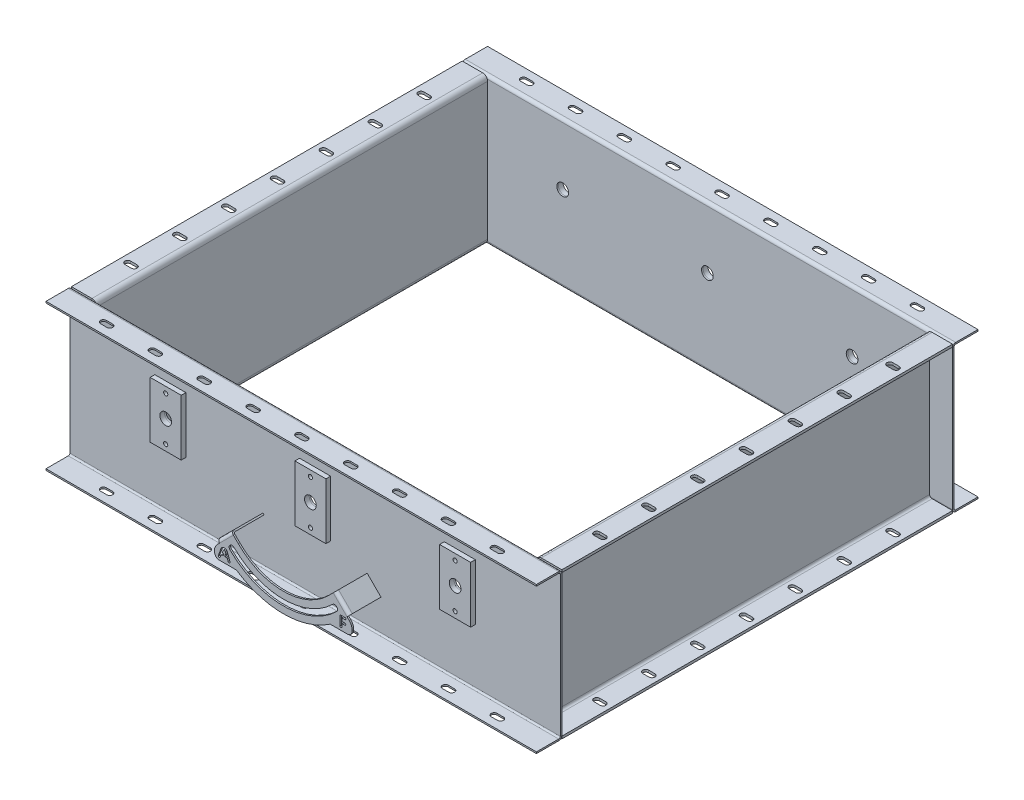
from build123d import *

# Parameters (mm, degrees)
ESBO_O7_W                                      = 5
ESBO_O7_H                                      = 300
FLANGE_BASE2_DEPTH                             = 400
ARESTA_FLANGE1_STRIP_W                         = 30
ARESTA_FLANGE1_STRIP_H                         = 5
ARESTA_FLANGE1_STRIP_CUT_DEPTH                 = 800
ARESTA_FLANGE1_STRIP_2_W                       = 30
ARESTA_FLANGE1_STRIP_2_H                       = 5
ARESTA_FLANGE1_STRIP_CUT_2_DEPTH               = 800
ARESTA_FLANGE1_DEPTH                           = 800
ARESTA_FLANGE1_BEND_DEPTH                      = 800
CORTE_EXTRUS_O2_DEPTH                          = 709.522406138
PADR_O_LINEAR5_COUNT                           = 4
PADR_O_LINEAR5_PITCH                           = 100
PADR_O_LINEAR5_COL_COUNT                       = 4
PADR_O_LINEAR5_COL_PITCH                       = 100
PADR_OCIRCULAR1_COUNT                          = 2
FLANGE_BASE3_START                             = -502
ESBO_O20_W                                     = 3.18
ESBO_O20_H                                     = 300
FLANGE_BASE3_DEPTH                             = 1004
ARESTA_FLANGE2_STRIP_W                         = 19.08
ARESTA_FLANGE2_STRIP_H                         = 3.18
ARESTA_FLANGE2_STRIP_CUT_DEPTH                 = 1004
ARESTA_FLANGE2_STRIP_2_W                       = 19.08
ARESTA_FLANGE2_STRIP_2_H                       = 3.18
ARESTA_FLANGE2_STRIP_CUT_2_DEPTH               = 1004
ARESTA_FLANGE2_DEPTH                           = 1004
ARESTA_FLANGE2_BEND_DEPTH                      = 1004
CORTE_EXTRUS_O3_DEPTH                          = 740.126511499
PADR_O_LINEAR6_COUNT                           = 5
PADR_O_LINEAR6_PITCH                           = 100
PADR_O_LINEAR6_COL_COUNT                       = 5
PADR_O_LINEAR6_COL_PITCH                       = 100
PADR_OCIRCULAR2_COUNT                          = 2
ESBO_O18_W                                     = 9.525
ESBO_O18_H                                     = 63.5
BARRA_CHATA_ASTM_A36_BR_09_53_X_63_50_A3_DEPTH = 115
ESBO_O34_W                                     = 4.25
ESBO_O34_H                                     = 9.526
FURO_ROSCADO_DE_M101_AT_2_COUNT                = 2
FURO_ROSCADO_DE_M101_AT_2_PITCH                = 90
PADR_O_LINEAR1_COUNT                           = 2
PADR_O_LINEAR1_PITCH                           = 296.25
ESBO_O32_R                                     = 12
CORTE_EXTRUS_O1_DEPTH                          = 1044.895941665
FLANGE_BASE4_DEPTH                             = 3.18
ARESTA_FLANGE3_STRIP_W                         = 19.08
ARESTA_FLANGE3_STRIP_H                         = 3.18
ARESTA_FLANGE3_STRIP_CUT_DEPTH                 = 40
ARESTA_FLANGE3_STRIP_2_W                       = 19.08
ARESTA_FLANGE3_STRIP_2_H                       = 3.18
ARESTA_FLANGE3_STRIP_CUT_2_DEPTH               = 40
ARESTA_FLANGE3_DEPTH                           = 40
ARESTA_FLANGE3_BEND_DEPTH                      = 40
ABA2_DEPTH                                     = 3.18
CORTE_EXTRUS_O4_DEPTH                          = 3.18
FILETE1_R                                      = 20
FILETE2_R                                      = 10
CORTE_EXTRUS_O5_DEPTH                          = 3.18


# Sheet-metal steps are written as plain solids
with BuildPart() as part:
    # Flange-base2: sheet metal written as solids
    # Esboço7 → Flange-base2 (new, symmetric)
    with BuildSketch(Plane.XY):
        with Locations((-452.5, -150)):
            Rectangle(ESBO_O7_W, ESBO_O7_H)
    extrude(amount=FLANGE_BASE2_DEPTH, both=True)

    # Aresta-Flange1: sheet metal written as solids
    # Aresta-Flange1 strip (on a plane across the edge) → Aresta-Flange1 strip cut (cut)
    with BuildSketch(Plane(origin=(-455, 0, 400), x_dir=(0, -1, 0), z_dir=(0, 0, -1))):
        with Locations((-5, -2.5)):
            Rectangle(ARESTA_FLANGE1_STRIP_W, ARESTA_FLANGE1_STRIP_H)
    extrude(amount=ARESTA_FLANGE1_STRIP_CUT_DEPTH, mode=Mode.SUBTRACT)

    # Aresta-Flange1 strip 2 (on a plane across the edge) → Aresta-Flange1 strip cut 2 (cut)
    with BuildSketch(Plane(origin=(-455, -300, -400), x_dir=(0, 1, 0), z_dir=(0, 0, 1))):
        with Locations((-5, -2.5)):
            Rectangle(ARESTA_FLANGE1_STRIP_2_W, ARESTA_FLANGE1_STRIP_2_H)
    extrude(amount=ARESTA_FLANGE1_STRIP_CUT_2_DEPTH, mode=Mode.SUBTRACT)

    # Aresta-Flange1 section (on a plane across the edge) → Aresta-Flange1 (add)
    with BuildSketch(Plane(origin=(-455, 0, 400), x_dir=(0, -1, 0), z_dir=(0, 0, -1))):
        with BuildLine():
            Line((0, 5), (0, 47))
            Line((0, 47), (5, 47))
            Line((5, 47), (5, 5))
            ThreePointArc((5, 5), (6.464466094, 1.464466094), (10, 0))
            Line((10, 0), (10, -5))
            ThreePointArc((10, -5), (2.928932188, -2.071067812), (0, 5))
        make_face()
    extrude(amount=ARESTA_FLANGE1_DEPTH)

    # Aresta-Flange1 section 2 (on a plane across the edge) → Aresta-Flange1 bend (add)
    with BuildSketch(Plane(origin=(-455, -300, -400), x_dir=(0, 1, 0), z_dir=(0, 0, 1))):
        with BuildLine():
            Line((0, 5), (0, 47))
            Line((0, 47), (5, 47))
            Line((5, 47), (5, 5))
            ThreePointArc((5, 5), (6.464466094, 1.464466094), (10, 0))
            Line((10, 0), (10, -5))
            ThreePointArc((10, -5), (2.928932188, -2.071067812), (0, 5))
        make_face()
    extrude(amount=ARESTA_FLANGE1_BEND_DEPTH)

    # Esboço52 → Corte-extrusão2 (cut, through all)
    with BuildSketch(Plane(origin=(0, 0, 0), x_dir=(1, 0, 0), z_dir=(0, 1, 0))):
        with BuildLine():
            Line((-486.5, 6), (-473.5, 6))
            ThreePointArc((-473.5, 6), (-467.5, 0), (-473.5, -6))
            Line((-473.5, -6), (-486.5, -6))
            ThreePointArc((-486.5, -6), (-492.5, 0), (-486.5, 6))
        make_face()
    corte_extrus_o2 = extrude(amount=-CORTE_EXTRUS_O2_DEPTH, mode=Mode.SUBTRACT)

    # Padrão linear5: Corte-extrusão2 ×4
    with Locations(*[(0, 0, -i * PADR_O_LINEAR5_PITCH) for i in range(1, PADR_O_LINEAR5_COUNT)]):
        add(corte_extrus_o2, mode=Mode.SUBTRACT)

    # Padrão linear5 col: Corte-extrusão2 ×4
    with Locations(*[(0, 0, i * PADR_O_LINEAR5_COL_PITCH) for i in range(1, PADR_O_LINEAR5_COL_COUNT)]):
        add(corte_extrus_o2, mode=Mode.SUBTRACT)


with BuildPart() as padr_ocircular1_1:
    # PadrãoCircular1: pattern copy
    add(part.part.rotate(Axis((0, 0, 0), (0, 1, 0)), 1 * 360 / PADR_OCIRCULAR1_COUNT))


with BuildPart() as body_3:
    # Flange-base3: sheet metal written as solids
    # Esboço20 → Flange-base3 (new body)
    with BuildSketch(Plane(origin=(0, 0, 0), x_dir=(0, 0, -1), z_dir=(1, 0, 0)).offset(FLANGE_BASE3_START)):
        with Locations((-401.59, -150)):
            Rectangle(ESBO_O20_W, ESBO_O20_H)
    extrude(amount=FLANGE_BASE3_DEPTH)

    # Aresta-Flange2: sheet metal written as solids
    # Aresta-Flange2 strip (on a plane across the edge) → Aresta-Flange2 strip cut (cut)
    with BuildSketch(Plane(origin=(502, 0, 403.18), x_dir=(0, -1, 0), z_dir=(-1, 0, 0))):
        with Locations((-3.18, -1.59)):
            Rectangle(ARESTA_FLANGE2_STRIP_W, ARESTA_FLANGE2_STRIP_H)
    extrude(amount=ARESTA_FLANGE2_STRIP_CUT_DEPTH, mode=Mode.SUBTRACT)

    # Aresta-Flange2 strip 2 (on a plane across the edge) → Aresta-Flange2 strip cut 2 (cut)
    with BuildSketch(Plane(origin=(-502, -300, 403.18), x_dir=(0, 1, 0), z_dir=(1, 0, 0))):
        with Locations((-3.18, -1.59)):
            Rectangle(ARESTA_FLANGE2_STRIP_2_W, ARESTA_FLANGE2_STRIP_2_H)
    extrude(amount=ARESTA_FLANGE2_STRIP_CUT_2_DEPTH, mode=Mode.SUBTRACT)

    # Aresta-Flange2 section (on a plane across the edge) → Aresta-Flange2 (add)
    with BuildSketch(Plane(origin=(502, 0, 403.18), x_dir=(0, -1, 0), z_dir=(-1, 0, 0))):
        with BuildLine():
            Line((0, 3.18), (0, 48.82))
            Line((0, 48.82), (3.18, 48.82))
            Line((3.18, 48.82), (3.18, 3.18))
            ThreePointArc((3.18, 3.18), (4.111400436, 0.931400436), (6.36, 0))
            Line((6.36, 0), (6.36, -3.18))
            ThreePointArc((6.36, -3.18), (1.862800872, -1.317199128), (0, 3.18))
        make_face()
    extrude(amount=ARESTA_FLANGE2_DEPTH)

    # Aresta-Flange2 section 2 (on a plane across the edge) → Aresta-Flange2 bend (add)
    with BuildSketch(Plane(origin=(-502, -300, 403.18), x_dir=(0, 1, 0), z_dir=(1, 0, 0))):
        with BuildLine():
            Line((0, 3.18), (0, 48.82))
            Line((0, 48.82), (3.18, 48.82))
            Line((3.18, 48.82), (3.18, 3.18))
            ThreePointArc((3.18, 3.18), (4.111400436, 0.931400436), (6.36, 0))
            Line((6.36, 0), (6.36, -3.18))
            ThreePointArc((6.36, -3.18), (1.862800872, -1.317199128), (0, 3.18))
        make_face()
    extrude(amount=ARESTA_FLANGE2_BEND_DEPTH)

    # Esboço53 → Corte-extrusão3 (cut, through all)
    with BuildSketch(Plane(origin=(0, 0, 0), x_dir=(1, 0, 0), z_dir=(0, 1, 0))):
        with BuildLine():
            Line((-6.5, -424), (6.5, -424))
            ThreePointArc((6.5, -424), (12.5, -430), (6.5, -436))
            Line((6.5, -436), (-6.5, -436))
            ThreePointArc((-6.5, -436), (-12.5, -430), (-6.5, -424))
        make_face()
    corte_extrus_o3 = extrude(amount=-CORTE_EXTRUS_O3_DEPTH, mode=Mode.SUBTRACT)

    # Padrão linear6: Corte-extrusão3 ×5
    with Locations(*[(i * PADR_O_LINEAR6_PITCH, 0, 0) for i in range(1, PADR_O_LINEAR6_COUNT)]):
        add(corte_extrus_o3, mode=Mode.SUBTRACT)

    # Padrão linear6 col: Corte-extrusão3 ×5
    with Locations(*[(-i * PADR_O_LINEAR6_COL_PITCH, 0, 0) for i in range(1, PADR_O_LINEAR6_COL_COUNT)]):
        add(corte_extrus_o3, mode=Mode.SUBTRACT)


with BuildPart() as padr_ocircular2_1:
    # PadrãoCircular2: pattern copy
    add(body_3.part.rotate(Axis((0, 0, 0), (0, 1, 0)), 1 * 360 / PADR_OCIRCULAR2_COUNT))


with BuildPart() as body_5:
    # Esboço18 → Barra chata astm a36 BR 09,53 X 63,50 A36(1) (new body)
    with BuildSketch(Plane(origin=(-296.25, -67.5, 407.9425), x_dir=(0, 0, 1), z_dir=(0, -1, 0))):
        Rectangle(ESBO_O18_W, ESBO_O18_H)
    extrude(amount=BARRA_CHATA_ASTM_A36_BR_09_53_X_63_50_A3_DEPTH)

    # Esboço34 → Furo roscado de M101 (revolve, cut)
    with BuildSketch(Plane(origin=(-296.25, -80, 412.705), x_dir=(0, -1, 0), z_dir=(1, 0, 0))):
        with Locations((2.125, 4.763)):
            Rectangle(ESBO_O34_W, ESBO_O34_H)
    furo_roscado_de_m101 = revolve(axis=Axis((-296.25, -80, 419.055), (0, 0, -1)), mode=Mode.SUBTRACT)

    # Furo roscado de M101 at 2: Furo roscado de M101 ×2
    with Locations(*[(0, -i * FURO_ROSCADO_DE_M101_AT_2_PITCH, 0) for i in range(1, FURO_ROSCADO_DE_M101_AT_2_COUNT)]):
        add(furo_roscado_de_m101, mode=Mode.SUBTRACT)


with BuildPart() as body_6:
    # Espelhar1: mirrored copy
    add(body_5.part.mirror(Plane(origin=(0, 0, 0), x_dir=(0, 0, 1), z_dir=(1, 0, 0))))


with BuildPart() as padr_o_linear1_1:
    # Padrão linear1: pattern copy
    add(body_5.part.moved(Location(Vector(1, 0, 0) * (1 * PADR_O_LINEAR1_PITCH))))


with BuildPart() as body_8:
    # Espelhar2: mirrored copy
    add(body_5.part.mirror(Plane.XY))


with BuildPart() as body_9:
    # Espelhar2 2: mirrored copy
    add(body_6.part.mirror(Plane.XY))


with BuildPart() as body_10:
    # Espelhar2 3: mirrored copy
    add(padr_o_linear1_1.part.mirror(Plane.XY))


with BuildPart() as corte_extrus_o1_tool:
    # Esboço32 → Corte-extrusão1 (new, through all)
    with BuildSketch(Plane.XY.offset(412.705)):
        with Locations((-296.25, -125)):
            Circle(ESBO_O32_R)
        with Locations((296.25, -125)):
            Circle(ESBO_O32_R)
        with Locations((0, -125)):
            Circle(ESBO_O32_R)
    extrude(amount=-CORTE_EXTRUS_O1_DEPTH)


with BuildPart() as body_3_1:
    add(body_3.part)

    # Corte-extrusão1: cut by corte_extrus_o1_tool
    add(corte_extrus_o1_tool.part, mode=Mode.SUBTRACT)


with BuildPart() as padr_ocircular2_1_1:
    add(padr_ocircular2_1.part)

    # Corte-extrusão1: cut by corte_extrus_o1_tool
    add(corte_extrus_o1_tool.part, mode=Mode.SUBTRACT)


with BuildPart() as body_5_1:
    add(body_5.part)

    # Corte-extrusão1: cut by corte_extrus_o1_tool
    add(corte_extrus_o1_tool.part, mode=Mode.SUBTRACT)


with BuildPart() as body_6_1:
    add(body_6.part)

    # Corte-extrusão1: cut by corte_extrus_o1_tool
    add(corte_extrus_o1_tool.part, mode=Mode.SUBTRACT)


with BuildPart() as padr_o_linear1_1_1:
    add(padr_o_linear1_1.part)

    # Corte-extrusão1: cut by corte_extrus_o1_tool
    add(corte_extrus_o1_tool.part, mode=Mode.SUBTRACT)


with BuildPart() as body_8_1:
    add(body_8.part)

    # Corte-extrusão1: cut by corte_extrus_o1_tool
    add(corte_extrus_o1_tool.part, mode=Mode.SUBTRACT)


with BuildPart() as body_9_1:
    add(body_9.part)

    # Corte-extrusão1: cut by corte_extrus_o1_tool
    add(corte_extrus_o1_tool.part, mode=Mode.SUBTRACT)


with BuildPart() as body_10_1:
    add(body_10.part)

    # Corte-extrusão1: cut by corte_extrus_o1_tool
    add(corte_extrus_o1_tool.part, mode=Mode.SUBTRACT)


with BuildPart() as body_11:
    # Flange-base4: sheet metal written as solids
    # Esboço35 → Flange-base4 (new body)
    with BuildSketch(Plane.XY.offset(468.18)):
        with BuildLine():
            Line((91.923881554, -216.923881554), (106.715728753, -202.132034356))
            Line((106.715728753, -202.132034356), (135, -230.416305603))
            Line((135, -230.416305603), (120.208152802, -245.208152802))
            ThreePointArc((120.208152802, -245.208152802), (0, -295), (-120.208152802, -245.208152802))
            Line((-120.208152802, -245.208152802), (-135, -230.416305603))
            Line((-135, -230.416305603), (-106.715728753, -202.132034356))
            Line((-106.715728753, -202.132034356), (-91.923881554, -216.923881554))
            ThreePointArc((-91.923881554, -216.923881554), (0, -255), (91.923881554, -216.923881554))
        make_face()
        with BuildLine():
            ThreePointArc((-100.8, -227.836569371), (-109.284857057, -227.921426428), (-109.2, -236.406283485))
            ThreePointArc((-109.2, -236.406283485), (0, -281), (109.2, -236.406283485))
            ThreePointArc((109.2, -236.406283485), (109.284857057, -227.921426428), (100.8, -227.836569371))
            ThreePointArc((100.8, -227.836569371), (0, -269), (-100.8, -227.836569371))
        make_face(mode=Mode.SUBTRACT)
    extrude(amount=-FLANGE_BASE4_DEPTH)

    # Aresta-Flange3: sheet metal written as solids
    # Aresta-Flange3 strip (on a plane across the edge) → Aresta-Flange3 strip cut (cut)
    with BuildSketch(Plane(origin=(106.715728753, -202.132034356, 465), x_dir=(-0.7071067811865474, -0.7071067811865477, -3.4914813388431334e-15), z_dir=(0.7071067811865477, -0.7071067811865474, 0))):
        with Locations((-3.18, -1.59)):
            Rectangle(ARESTA_FLANGE3_STRIP_W, ARESTA_FLANGE3_STRIP_H)
    extrude(amount=ARESTA_FLANGE3_STRIP_CUT_DEPTH, mode=Mode.SUBTRACT)

    # Aresta-Flange3 strip 2 (on a plane across the edge) → Aresta-Flange3 strip cut 2 (cut)
    with BuildSketch(Plane(origin=(-135, -230.416305603, 465), x_dir=(0.7071067811865478, -0.7071067811865475, -3.491481338843134e-15), z_dir=(0.7071067811865475, 0.7071067811865478, 0))):
        with Locations((-3.18, -1.59)):
            Rectangle(ARESTA_FLANGE3_STRIP_2_W, ARESTA_FLANGE3_STRIP_2_H)
    extrude(amount=ARESTA_FLANGE3_STRIP_CUT_2_DEPTH, mode=Mode.SUBTRACT)

    # Aresta-Flange3 section (on a plane across the edge) → Aresta-Flange3 (add)
    with BuildSketch(Plane(origin=(106.715728753, -202.132034356, 465), x_dir=(-0.7071067811865474, -0.7071067811865477, -3.4914813388431334e-15), z_dir=(0.7071067811865477, -0.7071067811865474, 0))):
        with BuildLine():
            Line((0, 3.18), (0, 61.82))
            Line((0, 61.82), (3.18, 61.82))
            Line((3.18, 61.82), (3.18, 3.18))
            ThreePointArc((3.18, 3.18), (4.111400436, 0.931400436), (6.36, 0))
            Line((6.36, 0), (6.36, -3.18))
            ThreePointArc((6.36, -3.18), (1.862800872, -1.317199128), (0, 3.18))
        make_face()
    extrude(amount=ARESTA_FLANGE3_DEPTH)

    # Aresta-Flange3 section 2 (on a plane across the edge) → Aresta-Flange3 bend (add)
    with BuildSketch(Plane(origin=(-135, -230.416305603, 465), x_dir=(0.7071067811865478, -0.7071067811865475, -3.491481338843134e-15), z_dir=(0.7071067811865475, 0.7071067811865478, 0))):
        with BuildLine():
            Line((0, 3.18), (0, 61.82))
            Line((0, 61.82), (3.18, 61.82))
            Line((3.18, 61.82), (3.18, 3.18))
            ThreePointArc((3.18, 3.18), (4.111400436, 0.931400436), (6.36, 0))
            Line((6.36, 0), (6.36, -3.18))
            ThreePointArc((6.36, -3.18), (1.862800872, -1.317199128), (0, 3.18))
        make_face()
    extrude(amount=ARESTA_FLANGE3_BEND_DEPTH)

    # Aba2: sheet metal written as solids
    # Esboço54 → Aba2 (add)
    with BuildSketch(Plane.XY.offset(468.18)):
        with BuildLine():
            Line((-130.502800872, -234.913504732), (-140.934067172, -245.344771032))
            Line((-140.934067172, -245.344771032), (-140.934067172, -265.344771032))
            Line((-140.934067172, -265.344771032), (-95.934067172, -265.344771032))
            ThreePointArc((-95.934067172, -265.344771032), (-108.53909739, -255.840606609), (-120.208152802, -245.208152802))
            Line((-120.208152802, -245.208152802), (-130.502800872, -234.913504732))
        make_face()
        with BuildLine():
            Line((130.502800872, -234.913504732), (140.934067172, -245.344771032))
            Line((140.934067172, -245.344771032), (140.934067172, -265.344771032))
            Line((140.934067172, -265.344771032), (95.934067172, -265.344771032))
            ThreePointArc((95.934067172, -265.344771032), (108.53909739, -255.840606609), (120.208152802, -245.208152802))
            Line((120.208152802, -245.208152802), (130.502800872, -234.913504732))
        make_face()
    extrude(amount=-ABA2_DEPTH)

    # Esboço59 → Corte-extrusão4 (cut)
    with BuildSketch(Plane.XY.offset(468.18)):
        with BuildLine():
            Line((-132.815602425, -257.666666991), (-127.519440558, -242.971406888))
            ThreePointArc((-127.519440558, -242.971406888), (-120.934067172, -238.344771032), (-114.348693785, -242.971406888))
            Line((-114.348693785, -242.971406888), (-109.052531918, -257.666666991))
            ThreePointArc((-109.052531918, -257.666666991), (-110.255963131, -260.226306285), (-112.815602425, -259.022875073))
            Line((-112.815602425, -259.022875073), (-114.385576891, -254.666666991))
            ThreePointArc((-114.385576891, -254.666666991), (-115.1173748, -253.70827965), (-116.267112144, -253.344771032))
            Line((-116.267112144, -253.344771032), (-118.934067172, -253.344771032))
            Line((-118.934067172, -253.344771032), (-118.934067172, -249.344771032))
            Line((-118.934067172, -249.344771032), (-118.429508112, -249.344771032))
            ThreePointArc((-118.429508112, -249.344771032), (-117.611262422, -248.919639703), (-117.488740486, -248.005719011))
            Line((-117.488740486, -248.005719011), (-119.052531918, -243.666666991))
            ThreePointArc((-119.052531918, -243.666666991), (-120.934067172, -242.344771032), (-122.815602425, -243.666666991))
            Line((-122.815602425, -243.666666991), (-124.379393857, -248.005719011))
            ThreePointArc((-124.379393857, -248.005719011), (-124.256871921, -248.919639703), (-123.438626231, -249.344771032))
            Line((-123.438626231, -249.344771032), (-122.934067172, -249.344771032))
            Line((-122.934067172, -249.344771032), (-122.934067172, -253.344771032))
            Line((-122.934067172, -253.344771032), (-125.601022199, -253.344771032))
            ThreePointArc((-125.601022199, -253.344771032), (-126.750759543, -253.70827965), (-127.482557453, -254.666666991))
            Line((-127.482557453, -254.666666991), (-129.052531918, -259.022875073))
            ThreePointArc((-129.052531918, -259.022875073), (-131.612171213, -260.226306285), (-132.815602425, -257.666666991))
        make_face()
    extrude(amount=-CORTE_EXTRUS_O4_DEPTH, mode=Mode.SUBTRACT)

    # Filete1
    filete1_edges = [body_11.edges().sort_by_distance(p)[0] for p in [
        (-140.934067172, -245.344771032, 466.59),
        (140.934067172, -245.344771032, 466.59),
    ]]
    fillet(filete1_edges, radius=FILETE1_R)

    # Filete2
    filete2_edges = [body_11.edges().sort_by_distance(p)[0] for p in [
        (-140.934067172, -265.344771032, 466.59),
        (140.934067172, -265.344771032, 466.59),
    ]]
    fillet(filete2_edges, radius=FILETE2_R)

    # Esboço60 → Corte-extrusão5 (cut)
    with BuildSketch(Plane.XY.offset(468.18)):
        with BuildLine():
            Line((115.934067172, -258.344771032), (115.934067172, -240.344771032))
            ThreePointArc((115.934067172, -240.344771032), (116.519853609, -238.930557469), (117.934067172, -238.344771032))
            Line((117.934067172, -238.344771032), (125.934067172, -238.344771032))
            ThreePointArc((125.934067172, -238.344771032), (127.934067172, -240.344771032), (125.934067172, -242.344771032))
            Line((125.934067172, -242.344771032), (119.934067172, -242.344771032))
            Line((119.934067172, -242.344771032), (119.934067172, -248.344771032))
            Line((119.934067172, -248.344771032), (125.934067172, -248.344771032))
            ThreePointArc((125.934067172, -248.344771032), (127.934067172, -250.344771032), (125.934067172, -252.344771032))
            Line((125.934067172, -252.344771032), (119.934067172, -252.344771032))
            Line((119.934067172, -252.344771032), (119.934067172, -258.344771032))
            ThreePointArc((119.934067172, -258.344771032), (117.934067172, -260.344771032), (115.934067172, -258.344771032))
        make_face()
    extrude(amount=-CORTE_EXTRUS_O5_DEPTH, mode=Mode.SUBTRACT)


solid = Compound([part.part, padr_ocircular1_1.part, body_3_1.part, padr_ocircular2_1_1.part, body_5_1.part, body_6_1.part, padr_o_linear1_1_1.part, body_8_1.part, body_9_1.part, body_10_1.part, body_11.part])
